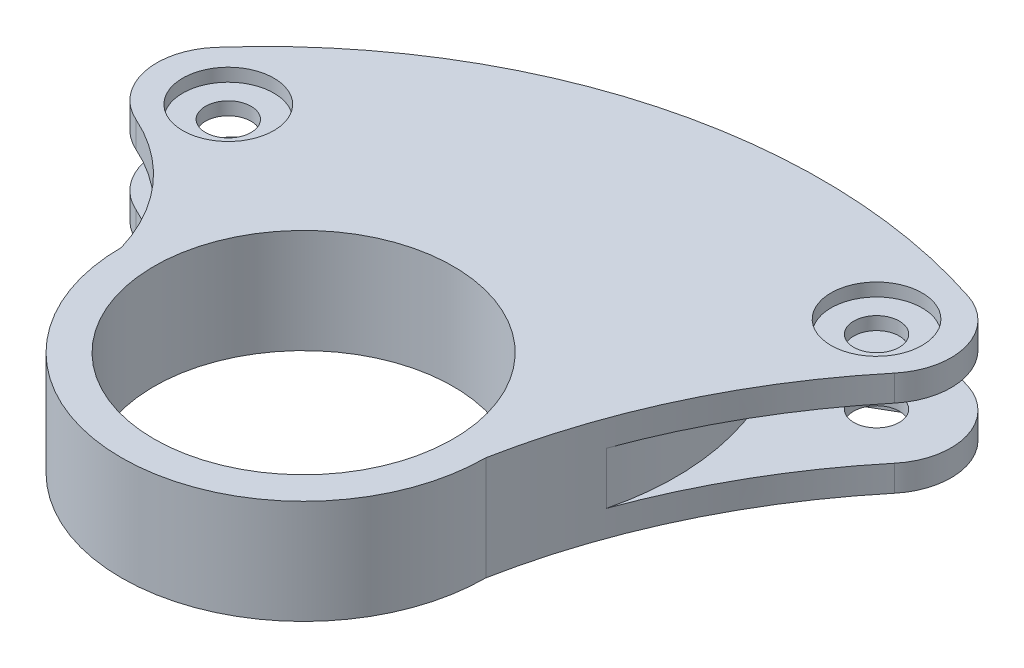
from build123d import *

# Parameters (mm, degrees)
SKETCH1_R               = 11.5
BOSS_EXTRUDE1_DEPTH     = 8
FILLET1_R               = 5
SKETCH2_R               = 1.75
CUT_EXTRUDE1_DEPTH      = 42.086920514
CUT_EXTRUDE2_DEPTH      = 2
CUT_EXTRUDE2_DEPTH_BACK = 2
CUT_EXTRUDE3_DEPTH      = 1
SKETCH6_R               = 3.5
CUT_EXTRUDE4_DEPTH      = 1


with BuildPart() as part:
    # Sketch1 → Boss-Extrude1 (new body)
    with BuildSketch(Plane(origin=(0, 0, 0), x_dir=(1, 0, 0), z_dir=(0, 1, 0))):
        with BuildLine():
            ThreePointArc((-14, 0), (-19.471857969, 7.655708558), (-28.497827605, 10.31709453))
            ThreePointArc((-28.497827605, 10.31709453), (-3.073557623, 29.860021883), (28.792425689, 26.271342282))
            ThreePointArc((28.792425689, 26.271342282), (19.254786977, 14.341429213), (14, 0))
            ThreePointArc((14, 0), (0, -14), (-14, 0))
        make_face()
        Circle(SKETCH1_R, mode=Mode.SUBTRACT)
    extrude(amount=BOSS_EXTRUDE1_DEPTH)

    # Fillet1
    fillet1_edges = [part.edges().sort_by_distance(p)[0] for p in [
        (-28.497827605, 4, -10.31709453),
        (28.792425689, 4, -26.271342282),
    ]]
    fillet(fillet1_edges, radius=FILLET1_R)

    # Sketch2 → Cut-Extrude1 (cut, through all)
    with BuildSketch(Plane(origin=(0, 8, 0), x_dir=(1, 0, 0), z_dir=(0, 1, 0))):
        with Locations((19.792155742, 24.244012032)):
            Circle(SKETCH2_R)
        with Locations((-19.418228464, 13.6297798)):
            Circle(SKETCH2_R)
    extrude(amount=-CUT_EXTRUDE1_DEPTH, mode=Mode.SUBTRACT)

    # Sketch4 → Cut-Extrude2 (cut, two sides: drawn at the far end of the back side and taken through both)
    with BuildSketch(Plane(origin=(0, 4, 0), x_dir=(1, 0, 0), z_dir=(0, 1, 0)).offset(-CUT_EXTRUDE2_DEPTH_BACK)):
        with BuildLine():
            Line((1.835095534, 30.921319118), (2.850978462, 31.937202047))
            Line((2.850978462, 31.937202047), (26.315238023, 31.937202047))
            Line((26.315238023, 31.937202047), (26.315238023, 18.871321935))
            Line((26.315238023, 18.871321935), (16.005221609, 7.26974549))
            ThreePointArc((16.005221609, 7.26974549), (13.818559855, 22.030261505), (1.835095534, 30.921319118))
        make_face()
        with BuildLine():
            Line((-7.393172326, 28.405304622), (-8.969342121, 29.213453182))
            Line((-8.969342121, 29.213453182), (-26.218946584, 19.349858218))
            Line((-26.218946584, 19.349858218), (-26.218946584, 10.374454271))
            Line((-26.218946584, 10.374454271), (-15.100414417, 2.682286291))
            ThreePointArc((-15.100414417, 2.682286291), (-15.070312018, 16.689414662), (-7.393172326, 28.405304622))
        make_face()
    extrude(amount=CUT_EXTRUDE2_DEPTH + CUT_EXTRUDE2_DEPTH_BACK, mode=Mode.SUBTRACT)

    # Sketch5 → Cut-Extrude3 (cut)
    with BuildSketch(Plane.XZ):
        Polygon((-16.406066272, -14.804604154), (-16.894719633, -11.608582998), (-19.906881824, -10.433758644), (-22.430390656, -12.454955445), (-21.941737296, -15.650976601), (-18.929575104, -16.825800955), align=None)
        Polygon((19.792155742, -21.010850524), (16.992155742, -22.627431278), (16.992155742, -25.860592785), (19.792155742, -27.477173539), (22.592155742, -25.860592785), (22.592155742, -22.627431278), align=None)
    extrude(amount=-CUT_EXTRUDE3_DEPTH, mode=Mode.SUBTRACT)

    # Sketch6 → Cut-Extrude4 (cut)
    with BuildSketch(Plane(origin=(0, 8, 0), x_dir=(1, 0, 0), z_dir=(0, 1, 0))):
        with Locations((-19.418228464, 13.6297798)):
            Circle(SKETCH6_R)
        with Locations((19.792155742, 24.244012032)):
            Circle(SKETCH6_R)
    extrude(amount=-CUT_EXTRUDE4_DEPTH, mode=Mode.SUBTRACT)


solid = part.part
